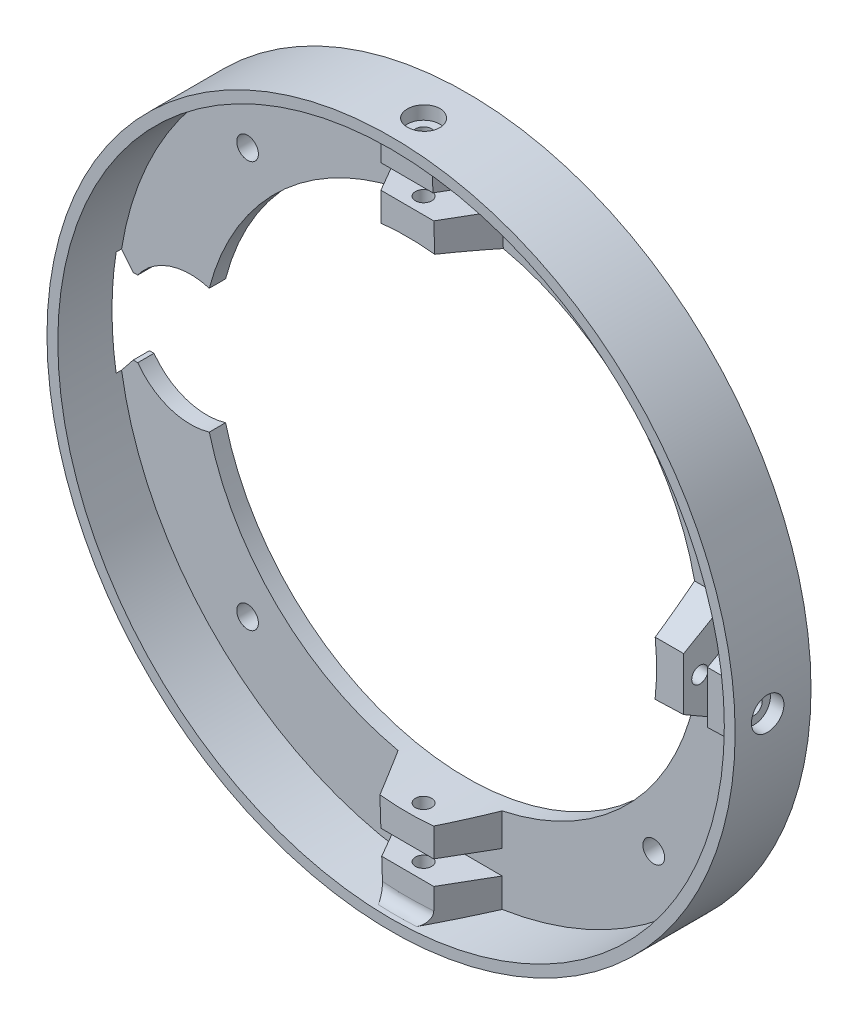
from build123d import *
from OCP.BRepFilletAPI import BRepFilletAPI_MakeChamfer

# Parameters (mm, degrees)
CUT_EXTRUDE1_DEPTH             = 4
CHAMFER1_SIZE                  = 4.528404541
BOSS_EXTRUDE1_START            = 8
BOSS_EXTRUDE1_DEPTH            = 8
CHAMFER2_SIZE                  = 8
CHAMFER2_SIZE_2                = 4.618802154
CIRPATTERN1_COUNT              = 3
CIRPATTERN1_ANGLE              = 180
CHAMFER2_OF_CIRPATTERN1_SIZE   = 8
CHAMFER2_OF_CIRPATTERN1_SIZE_2 = 4.618802154
FILLET1_R                      = 2
SKETCH4_R                      = 2
CUT_EXTRUDE2_DEPTH             = 10
SKETCH5_R                      = 1.5
CUT_EXTRUDE3_DEPTH             = 158
SKETCH7_R                      = 3
CUT_EXTRUDE5_DEPTH             = 4
CIRPATTERN3_COUNT              = 3
CIRPATTERN3_ANGLE              = 180


# Some blends are built 0.0001 mm under size
with BuildPart() as part:
    # Sketch1 → Revolve1 (revolve)
    with BuildSketch(Plane(origin=(0, 0, 0), x_dir=(1, 0, 0), z_dir=(0, 1, 0))):
        Polygon((-46, 0), (-46, -3), (-61.5, -3), (-61.5, -14), (-63.5, -14), (-63.5, 0), align=None)
    revolve(axis=Axis((0, 0, 0.5), (0, 0, 1)))

    # Sketch2 → Cut-Extrude1 (cut)
    with BuildSketch(Plane(origin=(0, 0, 0), x_dir=(-1, 0, 0), z_dir=(0, 0, -1))):
        with BuildLine():
            Line((57.746794345, 7), (73.255615774, 7))
            Line((73.255615774, 7), (73.255615774, -7))
            Line((73.255615774, -7), (57.746794345, -7))
            ThreePointArc((57.746794345, -7), (36, 0), (57.746794345, 7))
        make_face()
    extrude(amount=-CUT_EXTRUDE1_DEPTH, mode=Mode.SUBTRACT)

    # Chamfer1
    # the kernel refuses this chamfer: 5, 4.528404541 mm, written as the material it takes off along each edge
    with BuildSketch(Plane(origin=(-63.112993908, -7, 4), x_dir=(1, 0, 0), z_dir=(0, 0, -1))) as chamfer1_piece_1:
        with BuildLine():
            Line((CHAMFER1_SIZE, 0), (0.712866483, 4.767501749))
            ThreePointArc((0.712866483, 4.767501749), (0.321261242, 2.457711608), (0, 0))
            Line((0, 0), (CHAMFER1_SIZE, 0))
        make_face()
    extrude(amount=16.39656237, mode=Mode.SUBTRACT)
    with BuildSketch(Plane(origin=(-63.112993908, 7, 4), x_dir=(1, 0, 0), z_dir=(0, 0, -1))) as chamfer1_piece_2:
        with BuildLine():
            Line((CHAMFER1_SIZE, 0), (0.712866483, -4.767501749))
            ThreePointArc((0.712866483, -4.767501749), (0.321261242, -2.457711608), (0, 0))
            Line((0, 0), (CHAMFER1_SIZE, 0))
        make_face()
    extrude(amount=16.39656237, mode=Mode.SUBTRACT)

    # Sketch3 → Boss-Extrude1 (add)
    with BuildSketch(Plane.XY.offset(3).offset(BOSS_EXTRUDE1_START)):
        with BuildLine():
            Line((-9.502273243, -50.959479433), (-9.711670224, -44.963134471))
            ThreePointArc((-9.711670224, -44.963134471), (-0.109415415, -45.999869872), (9.497662676, -45.008825842))
            Line((9.497662676, -45.008825842), (9.497662676, -51.008825842))
            Line((9.497662676, -51.008825842), (-9.502273243, -50.959479433))
        make_face()
        with BuildLine():
            Line((9.497662676, -55.408840682), (-9.348607402, -55.359893372))
            Line((-9.348607402, -55.359893372), (-9.158135478, -60.814295643))
            ThreePointArc((-9.158135478, -60.814295643), (0.171750649, -61.499760176), (9.497662676, -60.762195514))
            Line((9.497662676, -60.762195514), (9.497662676, -55.408840682))
        make_face()
    boss_extrude1 = extrude(amount=-BOSS_EXTRUDE1_DEPTH)

    # Chamfer2
    chamfer2_edges_1 = [part.edges().sort_by_distance(p)[0] for p in [
        (-9.25337144, -58.087094508, 11),
    ]]
    chamfer2_side_1 = [part.faces().sort_by_distance(p)[0] for p in [
        (-9.25337144, -58.087094508, 10.907623957),
    ]]
    chamfer2_edges_2 = [part.edges().sort_by_distance(p)[0] for p in [
        (-9.606971733, -47.961306952, 11),
    ]]
    chamfer2_side_2 = [part.faces().sort_by_distance(p)[0] for p in [
        (-9.606971733, -47.961306952, 10.907623957),
    ]]
    chamfer2_edges_3 = [part.edges().sort_by_distance(p)[0] for p in [
        (9.497662676, -48.008825842, 11),
    ]]
    chamfer2_side_3 = [part.faces().sort_by_distance(p)[0] for p in [
        (9.497662676, -48.008825842, 10.907623957),
    ]]
    chamfer2_edges_4 = [part.edges().sort_by_distance(p)[0] for p in [
        (9.497662676, -58.085518098, 11),
    ]]
    chamfer2_side_4 = [part.faces().sort_by_distance(p)[0] for p in [
        (9.497662676, -58.085518098, 10.907623957),
    ]]
    chamfer2 = BRepFilletAPI_MakeChamfer(part.part.solid().wrapped)
    for e in chamfer2_edges_1:
        chamfer2.Add(CHAMFER2_SIZE - 0.0001, CHAMFER2_SIZE_2 - 0.0001, e.wrapped, chamfer2_side_1[0].wrapped)
    for e in chamfer2_edges_2:
        chamfer2.Add(CHAMFER2_SIZE - 0.0001, CHAMFER2_SIZE_2 - 0.0001, e.wrapped, chamfer2_side_2[0].wrapped)
    for e in chamfer2_edges_3:
        chamfer2.Add(CHAMFER2_SIZE - 0.0001, CHAMFER2_SIZE_2 - 0.0001, e.wrapped, chamfer2_side_3[0].wrapped)
    for e in chamfer2_edges_4:
        chamfer2.Add(CHAMFER2_SIZE - 0.0001, CHAMFER2_SIZE_2 - 0.0001, e.wrapped, chamfer2_side_4[0].wrapped)
    add(Compound.cast(chamfer2.Shape()), mode=Mode.REPLACE)  # a hair under: the kernel refuses the full size

    # CirPattern1: Boss-Extrude1 ×3 about axis
    cirpattern1_axis = Axis((0, 0, 0), (0, 0, 1))
    for i in range(1, CIRPATTERN1_COUNT):
        add(boss_extrude1.rotate(cirpattern1_axis, i * CIRPATTERN1_ANGLE / (CIRPATTERN1_COUNT - 1)))

    # Chamfer2 of CirPattern1
    chamfer2_of_cirpattern1_edges_1 = [part.edges().sort_by_distance(p)[0] for p in [
        (58.087094508, -9.25337144, 11),
    ]]
    chamfer2_of_cirpattern1_side_1 = [part.faces().sort_by_distance(p)[0] for p in [
        (58.087094508, -9.25337144, 10.907623957),
    ]]
    chamfer2_of_cirpattern1_edges_2 = [part.edges().sort_by_distance(p)[0] for p in [
        (47.961306952, -9.606971733, 11),
    ]]
    chamfer2_of_cirpattern1_side_2 = [part.faces().sort_by_distance(p)[0] for p in [
        (47.958083075, -9.514651963, 11),
    ]]
    chamfer2_of_cirpattern1_edges_3 = [part.edges().sort_by_distance(p)[0] for p in [
        (48.008825842, 9.497662676, 11),
    ]]
    chamfer2_of_cirpattern1_side_3 = [part.faces().sort_by_distance(p)[0] for p in [
        (48.008825842, 9.497662676, 10.907623957),
    ]]
    chamfer2_of_cirpattern1_edges_4 = [part.edges().sort_by_distance(p)[0] for p in [
        (58.085518098, 9.497662676, 11),
    ]]
    chamfer2_of_cirpattern1_side_4 = [part.faces().sort_by_distance(p)[0] for p in [
        (58.085518098, 9.497662676, 10.907623957),
    ]]
    chamfer2_of_cirpattern1_edges_5 = [part.edges().sort_by_distance(p)[0] for p in [
        (9.25337144, 58.087094508, 11),
    ]]
    chamfer2_of_cirpattern1_side_5 = [part.faces().sort_by_distance(p)[0] for p in [
        (9.25337144, 58.087094508, 10.907623957),
    ]]
    chamfer2_of_cirpattern1_edges_6 = [part.edges().sort_by_distance(p)[0] for p in [
        (9.606971733, 47.961306952, 11),
    ]]
    chamfer2_of_cirpattern1_side_6 = [part.faces().sort_by_distance(p)[0] for p in [
        (9.606971733, 47.961306952, 10.907623957),
    ]]
    chamfer2_of_cirpattern1_edges_7 = [part.edges().sort_by_distance(p)[0] for p in [
        (-9.497662676, 48.008825842, 11),
    ]]
    chamfer2_of_cirpattern1_side_7 = [part.faces().sort_by_distance(p)[0] for p in [
        (-9.497662676, 48.008825842, 10.907623957),
    ]]
    chamfer2_of_cirpattern1_edges_8 = [part.edges().sort_by_distance(p)[0] for p in [
        (-9.497662676, 58.085518098, 11),
    ]]
    chamfer2_of_cirpattern1_side_8 = [part.faces().sort_by_distance(p)[0] for p in [
        (-9.497662676, 58.085518098, 10.907623957),
    ]]
    chamfer2_of_cirpattern1 = BRepFilletAPI_MakeChamfer(part.part.solid().wrapped)
    for e in chamfer2_of_cirpattern1_edges_1:
        chamfer2_of_cirpattern1.Add(CHAMFER2_OF_CIRPATTERN1_SIZE - 0.0001, CHAMFER2_OF_CIRPATTERN1_SIZE_2 - 0.0001, e.wrapped, chamfer2_of_cirpattern1_side_1[0].wrapped)
    for e in chamfer2_of_cirpattern1_edges_2:
        chamfer2_of_cirpattern1.Add(CHAMFER2_OF_CIRPATTERN1_SIZE_2 - 0.0001, CHAMFER2_OF_CIRPATTERN1_SIZE - 0.0001, e.wrapped, chamfer2_of_cirpattern1_side_2[0].wrapped)
    for e in chamfer2_of_cirpattern1_edges_3:
        chamfer2_of_cirpattern1.Add(CHAMFER2_OF_CIRPATTERN1_SIZE - 0.0001, CHAMFER2_OF_CIRPATTERN1_SIZE_2 - 0.0001, e.wrapped, chamfer2_of_cirpattern1_side_3[0].wrapped)
    for e in chamfer2_of_cirpattern1_edges_4:
        chamfer2_of_cirpattern1.Add(CHAMFER2_OF_CIRPATTERN1_SIZE - 0.0001, CHAMFER2_OF_CIRPATTERN1_SIZE_2 - 0.0001, e.wrapped, chamfer2_of_cirpattern1_side_4[0].wrapped)
    for e in chamfer2_of_cirpattern1_edges_5:
        chamfer2_of_cirpattern1.Add(CHAMFER2_OF_CIRPATTERN1_SIZE - 0.0001, CHAMFER2_OF_CIRPATTERN1_SIZE_2 - 0.0001, e.wrapped, chamfer2_of_cirpattern1_side_5[0].wrapped)
    for e in chamfer2_of_cirpattern1_edges_6:
        chamfer2_of_cirpattern1.Add(CHAMFER2_OF_CIRPATTERN1_SIZE - 0.0001, CHAMFER2_OF_CIRPATTERN1_SIZE_2 - 0.0001, e.wrapped, chamfer2_of_cirpattern1_side_6[0].wrapped)
    for e in chamfer2_of_cirpattern1_edges_7:
        chamfer2_of_cirpattern1.Add(CHAMFER2_OF_CIRPATTERN1_SIZE - 0.0001, CHAMFER2_OF_CIRPATTERN1_SIZE_2 - 0.0001, e.wrapped, chamfer2_of_cirpattern1_side_7[0].wrapped)
    for e in chamfer2_of_cirpattern1_edges_8:
        chamfer2_of_cirpattern1.Add(CHAMFER2_OF_CIRPATTERN1_SIZE - 0.0001, CHAMFER2_OF_CIRPATTERN1_SIZE_2 - 0.0001, e.wrapped, chamfer2_of_cirpattern1_side_8[0].wrapped)
    add(Compound.cast(chamfer2_of_cirpattern1.Shape()), mode=Mode.REPLACE)  # a hair under: the kernel refuses the full size

    # Fillet1
    fillet1_edges = [part.edges().sort_by_distance(p)[0] for p in [
        (0.180770138, -61.499734326, 11),
        (61.499734326, 0.180770138, 11),
        (-0.180770138, 61.499734326, 11),
    ]]
    fillet(fillet1_edges, radius=FILLET1_R)

    # Sketch4 → Cut-Extrude2 (cut)
    with BuildSketch(Plane(origin=(0, 0, 0), x_dir=(-1, 0, 0), z_dir=(0, 0, -1))):
        with Locations((-37.476659403, 37.476659403)):
            Circle(SKETCH4_R)
        with Locations((37.476659403, 37.476659403)):
            Circle(SKETCH4_R)
        with Locations((37.476659403, -37.476659403)):
            Circle(SKETCH4_R)
        with Locations((-37.476659403, -37.476659403)):
            Circle(SKETCH4_R)
    extrude(amount=-CUT_EXTRUDE2_DEPTH, mode=Mode.SUBTRACT)

    # Sketch5 → Cut-Extrude3 (cut)
    with BuildSketch(Plane(origin=(0, 0, 0), x_dir=(1, 0, 0), z_dir=(0, 1, 0))):
        with Locations(Location((0, -8, 0), (0, 0, 270))):
            Circle(SKETCH5_R)
    cut_extrude3 = extrude(amount=-CUT_EXTRUDE3_DEPTH, mode=Mode.SUBTRACT)

    # Sketch7 → Cut-Extrude5 (cut)
    with BuildSketch(Plane(origin=(0, -65, 0), x_dir=(1, 0, 0), z_dir=(0, 1, 0))):
        with Locations(Location((0, -8, 0), (0, 0, 90))):
            Circle(SKETCH7_R)
    cut_extrude5 = extrude(amount=CUT_EXTRUDE5_DEPTH, mode=Mode.SUBTRACT)

    # CirPattern3: Cut-Extrude3, Cut-Extrude5 ×3 about axis
    cirpattern3_axis = Axis((0, 0, 0), (0, 0, 1))
    add([cut_extrude3.rotate(cirpattern3_axis, i * CIRPATTERN3_ANGLE / (CIRPATTERN3_COUNT - 1)) for i in range(1, CIRPATTERN3_COUNT)], mode=Mode.SUBTRACT)
    add([cut_extrude5.rotate(cirpattern3_axis, i * CIRPATTERN3_ANGLE / (CIRPATTERN3_COUNT - 1)) for i in range(1, CIRPATTERN3_COUNT)], mode=Mode.SUBTRACT)


solid = part.part
